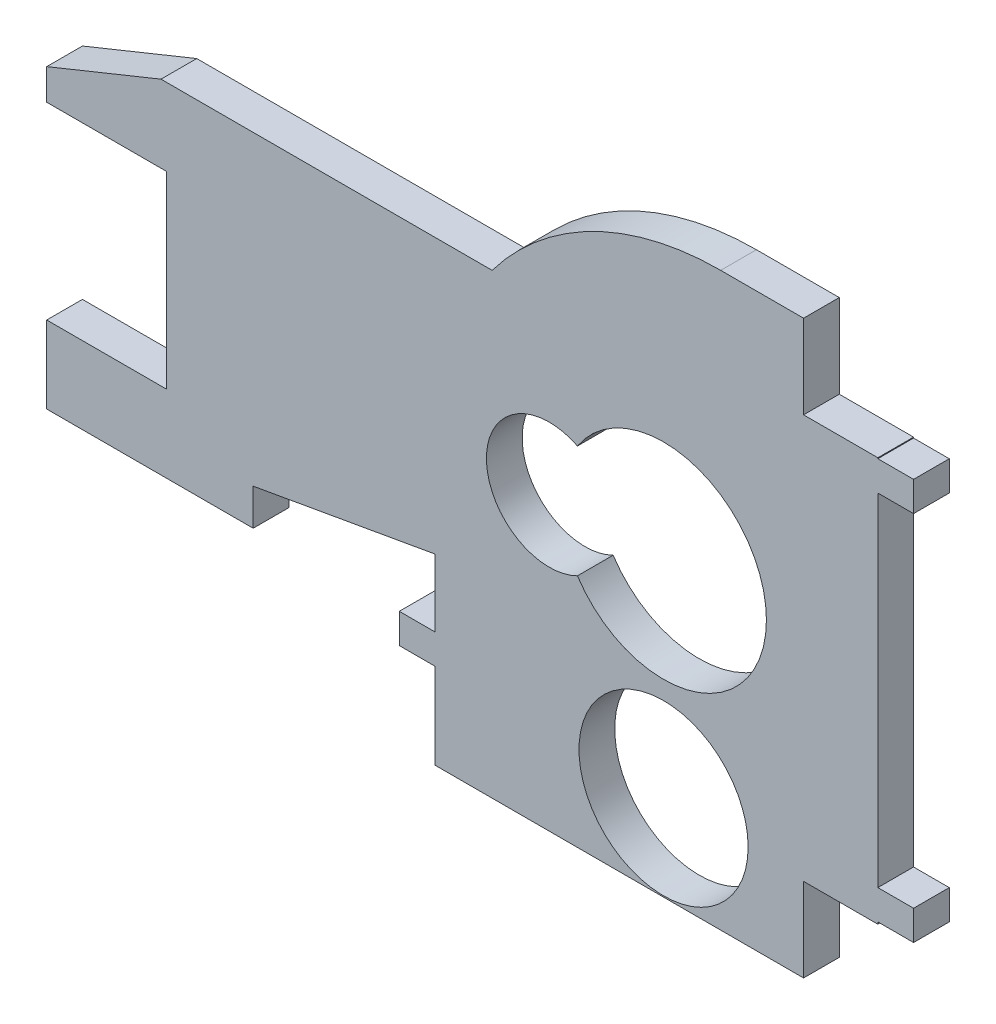
from build123d import *

# Parameters (mm, degrees)
SKETCH1_R           = 3.7592
BOSS_EXTRUDE1_DEPTH = 1.5875
CUT_EXTRUDE1_REACH  = 36.935
SKETCH2_W           = 3.302
SKETCH2_H           = 3.7211


with BuildPart() as part:
    # Sketch1 → Boss-Extrude1 (new body)
    with BuildSketch(Plane.XY):
        with BuildLine():
            Line((11.1125, 17.8308), (9.525, 17.8308))
            Line((9.525, 17.8308), (9.525, 21.59))
            Line((9.525, 21.59), (2.54, 21.59))
            ThreePointArc((2.54, 21.59), (-3.139612663, 20.249225326), (-7.62, 16.51))
            Line((-7.62, 16.51), (-22.338921519, 16.51))
            Line((-22.338921519, 16.51), (-27.418921519, 14.4526))
            Line((-27.418921519, 14.4526), (-27.418921519, 13.081))
            Line((-27.418921519, 13.081), (-22.084921519, 13.081))
            Line((-22.084921519, 13.081), (-22.084921519, 4.699))
            Line((-22.084921519, 4.699), (-27.418921519, 4.699))
            Line((-27.418921519, 4.699), (-27.418921519, 1.27))
            Line((-27.418921519, 1.27), (-18.241771939, 1.27))
            Line((-18.241771939, 1.27), (-18.241771939, 2.890724209))
            Line((-18.241771939, 2.890724209), (-10.16, 4.318))
            Line((-10.16, 4.318), (-10.16, 1.3208))
            Line((-10.16, 1.3208), (-11.7475, 1.3208))
            Line((-11.7475, 1.3208), (-11.7475, 0))
            Line((-11.7475, 0), (-10.16, 0))
            Line((-10.16, 0), (-10.16, -3.81))
            Line((-10.16, -3.81), (9.525, -3.81))
            Line((9.525, -3.81), (9.525, 0))
            Line((9.525, 0), (11.1125, 0))
            Line((11.1125, 0), (11.1125, 1.3208))
            Line((11.1125, 1.3208), (9.525, 1.3208))
            Line((9.525, 1.3208), (9.525, 16.51))
            Line((9.525, 16.51), (11.1125, 16.51))
            Line((11.1125, 16.51), (11.1125, 17.8308))
        make_face()
        with BuildLine():
            ThreePointArc((-3.82905, 6.645688551), (-7.874, 9.144), (-3.82905, 11.642311449))
            ThreePointArc((-3.82905, 11.642311449), (4.572, 9.144), (-3.82905, 6.645688551))
        make_face(mode=Mode.SUBTRACT)
        Circle(SKETCH1_R, mode=Mode.SUBTRACT)
    extrude(amount=BOSS_EXTRUDE1_DEPTH)

    # Sketch2 → Cut-Extrude1 (cut, up to next)
    with BuildSketch(Plane.XY.offset(1.5875), mode=Mode.PRIVATE) as cut_extrude1_sk1:
        with Locations((7.874, -1.94945)):
            Rectangle(SKETCH2_W, SKETCH2_H)
    cut_extrude1_tool1 = extrude(cut_extrude1_sk1.sketch, amount=-CUT_EXTRUDE1_REACH, mode=Mode.PRIVATE) & part.part
    # Sketch2 → Cut-Extrude1 (cut, up to next)
    with BuildSketch(Plane.XY.offset(1.5875), mode=Mode.PRIVATE) as cut_extrude1_sk2:
        with Locations((7.874, 19.72945)):
            Rectangle(SKETCH2_W, SKETCH2_H)
    cut_extrude1_tool2 = extrude(cut_extrude1_sk2.sketch, amount=-CUT_EXTRUDE1_REACH, mode=Mode.PRIVATE) & part.part
    add(cut_extrude1_tool1.solids().sort_by_distance((7.874, -1.94945, 1.5875))[0], mode=Mode.SUBTRACT)
    add(cut_extrude1_tool2.solids().sort_by_distance((7.874, 19.72945, 1.5875))[0], mode=Mode.SUBTRACT)


solid = part.part
